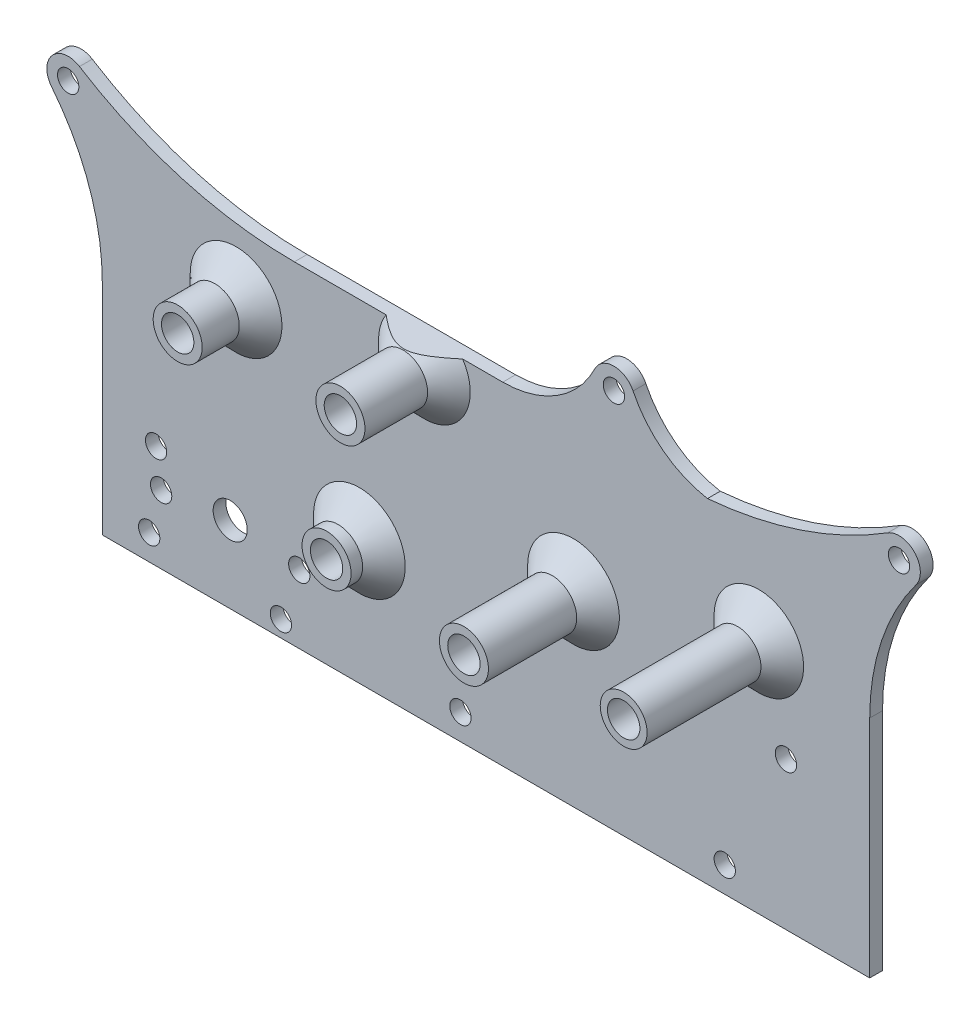
from build123d import *

# Parameters (mm, degrees)
SKETCH1_W           = 180
SKETCH1_H           = 78
SKETCH1_R           = 4
BOSS_EXTRUDE1_DEPTH = 3
SKETCH2_R           = 2.5
CUT_EXTRUDE1_DEPTH  = 3
SKETCH4_R           = 2.5
CUT_EXTRUDE3_DEPTH  = 10
SKETCH5_R           = 2.5
BOSS_EXTRUDE2_DEPTH = 3
SKETCH6_R           = 2.5
BOSS_EXTRUDE3_DEPTH = 3
SKETCH7_R           = 2.5
CUT_EXTRUDE4_DEPTH  = 179.975122888
SKETCH8_R           = 5.75
SKETCH8_R_2         = 3.8
BOSS_EXTRUDE4_DEPTH = 13.7
SKETCH9_R           = 5.75
SKETCH9_R_2         = 3.8
BOSS_EXTRUDE5_DEPTH = 7.7
SKETCH10_R          = 5.75
SKETCH10_R_2        = 3.8
BOSS_EXTRUDE6_DEPTH = 19.7
SKETCH11_R          = 5.75
SKETCH11_R_2        = 3.8
BOSS_EXTRUDE7_DEPTH = 25.7
CHAMFER1_SIZE       = 5
SKETCH12_R          = 5.5
SKETCH12_R_2        = 3.8
BOSS_EXTRUDE8_DEPTH = 31.7
CHAMFER2_SIZE       = 5
SKETCH13_R          = 2.5
CUT_EXTRUDE5_DEPTH  = 183.283253791


with BuildPart() as part:
    # Sketch1 → Boss-Extrude1 (new body)
    with BuildSketch(Plane.XY):
        with Locations((60, 21)):
            Rectangle(SKETCH1_W, SKETCH1_H)
        Circle(SKETCH1_R, mode=Mode.SUBTRACT)
    extrude(amount=BOSS_EXTRUDE1_DEPTH)

    # Sketch2 → Cut-Extrude1 (cut)
    with BuildSketch(Plane.XY.offset(3)):
        with Locations((1.379644584, 45.502149563)):
            Circle(SKETCH2_R)
        with Locations((30.30508702, 11.030149622)):
            Circle(SKETCH2_R)
        with Locations((45.55286784, 54.088554355)):
            Circle(SKETCH2_R)
        with Locations((80.524436105, 25.769136757)):
            Circle(SKETCH2_R)
        with Locations((123.991098288, 37.415993787)):
            Circle(SKETCH2_R)
        with Locations((130.350182866, 16.616365345)):
            Circle(SKETCH2_R)
    extrude(amount=-CUT_EXTRUDE1_DEPTH, mode=Mode.SUBTRACT)

    # Sketch4 → Cut-Extrude3 (cut)
    with BuildSketch(Plane.XY.offset(3)):
        with Locations((54, -12)):
            Circle(SKETCH4_R)
        with Locations((-19, -12)):
            Circle(SKETCH4_R)
        with Locations((116, -12)):
            Circle(SKETCH4_R)
    extrude(amount=-CUT_EXTRUDE3_DEPTH, mode=Mode.SUBTRACT)

    # Sketch5 → Boss-Extrude2 (add)
    # profile 1 of 2: a face of its own
    with BuildSketch(Plane.XY.offset(3)):
        with BuildLine():
            Line((116.068060007, 60), (116.068060007, 53.293456509))
            Line((116.068060007, 53.293456509), (63.931939993, 53.293456509))
            Line((63.931939993, 53.293456509), (63.931939993, 60))
            ThreePointArc((63.931939993, 60), (76.652430488, 63.648363172), (85.505506895, 73.48423987))
            ThreePointArc((85.505506895, 73.48423987), (90, 76.293456509), (94.494493105, 73.48423987))
            ThreePointArc((94.494493105, 73.48423987), (103.347569512, 63.648363172), (116.068060007, 60))
        make_face()
        with Locations((90, 71.293456509)):
            Circle(SKETCH5_R, mode=Mode.SUBTRACT)
    # profile 2 of 2: a face of its own
    with BuildSketch(Plane.XY.offset(3)):
        with BuildLine():
            Line((15.048465346, 60), (-9.629718418, 52.415464707))
            Line((-9.629718418, 52.415464707), (-30, 33.284639637))
            ThreePointArc((-30, 33.284639637), (-33.061352956, 51.208206171), (-41.898305085, 67.099537024))
            ThreePointArc((-41.898305085, 67.099537024), (-41.737026969, 73.552387313), (-35.347576733, 74.469018739))
            ThreePointArc((-35.347576733, 74.469018739), (-11.167529583, 63.688874665), (15.048465346, 60))
        make_face()
        with Locations((-38, 70.230546041)):
            Circle(SKETCH5_R, mode=Mode.SUBTRACT)
    extrude(amount=-BOSS_EXTRUDE2_DEPTH)

    # Sketch6 → Boss-Extrude3 (add)
    with BuildSketch(Plane.XY.offset(3)):
        with BuildLine():
            Line((103.71791688, 60), (150, 34.801241353))
            ThreePointArc((150, 34.801241353), (152.78836529, 51.929243873), (160.8654989, 67.28838981))
            ThreePointArc((160.8654989, 67.28838981), (160.554300014, 73.67838942), (154.213881277, 74.531636156))
            ThreePointArc((154.213881277, 74.531636156), (129.990577907, 63.705162892), (103.71791688, 60))
        make_face()
        with Locations((156.871563613, 70.296459112)):
            Circle(SKETCH6_R, mode=Mode.SUBTRACT)
    extrude(amount=-BOSS_EXTRUDE3_DEPTH)

    # Sketch7 → Cut-Extrude4 (cut, through all)
    with BuildSketch(Plane.XY.offset(3)):
        with Locations((11.891570779, -14.171822198)):
            Circle(SKETCH7_R)
        with Locations((-17.384313485, 6.327372652)):
            Circle(SKETCH7_R)
    extrude(amount=-CUT_EXTRUDE4_DEPTH, mode=Mode.SUBTRACT)

    # Sketch8 → Boss-Extrude4 (add)
    with BuildSketch(Plane.XY.offset(3)):
        with Locations(Location((1.379644584, 45.502149563, 0), (0, 0, 180))):
            Circle(SKETCH8_R)
        with Locations(Location((1.379644584, 45.502149563, 0), (0, 0, 180))):
            Circle(SKETCH8_R_2, mode=Mode.SUBTRACT)
    extrude(amount=BOSS_EXTRUDE4_DEPTH)

    # Sketch9 → Boss-Extrude5 (add)
    with BuildSketch(Plane.XY.offset(3)):
        with Locations(Location((30.30508702, 11.030149622, 0), (0, 0, 180))):
            Circle(SKETCH9_R)
        with Locations(Location((30.30508702, 11.030149622, 0), (0, 0, 180))):
            Circle(SKETCH9_R_2, mode=Mode.SUBTRACT)
    extrude(amount=BOSS_EXTRUDE5_DEPTH)

    # Sketch10 → Boss-Extrude6 (add)
    with BuildSketch(Plane.XY.offset(3)):
        with Locations(Location((45.55286784, 54.088554355, 0), (0, 0, 180))):
            Circle(SKETCH10_R)
        with Locations((45.55286784, 54.088554355)):
            Circle(SKETCH10_R_2, mode=Mode.SUBTRACT)
    extrude(amount=BOSS_EXTRUDE6_DEPTH)

    # Sketch11 → Boss-Extrude7 (add)
    with BuildSketch(Plane.XY.offset(3)):
        with Locations(Location((80.524436105, 25.769136757, 0), (0, 0, 180))):
            Circle(SKETCH11_R)
        with Locations(Location((80.524436105, 25.769136757, 0), (0, 0, 180))):
            Circle(SKETCH11_R_2, mode=Mode.SUBTRACT)
    extrude(amount=BOSS_EXTRUDE7_DEPTH)

    # Chamfer1
    # the kernel refuses this chamfer: 5 mm, written as the material it adds along each edge
    with BuildSketch(Plane(origin=(1.379644584, 45.502149563, 3), x_dir=(-1, 0, 0), z_dir=(0, 1, 0))) as chamfer1_piece_1:
        Polygon((5.75 + CHAMFER1_SIZE, 0), (5.75, CHAMFER1_SIZE), (5.75, 0), align=None)
    revolve(axis=Axis((1.379644584, 45.502149563, 3), (0, 0, 1)))
    with BuildSketch(Plane(origin=(30.30508702, 11.030149622, 3), x_dir=(-1, 0, 0), z_dir=(0, 1, 0))) as chamfer1_piece_2:
        Polygon((5.75 + CHAMFER1_SIZE, 0), (5.75, CHAMFER1_SIZE), (5.75, 0), align=None)
    revolve(axis=Axis((30.30508702, 11.030149622, 3), (0, 0, 1)))
    with BuildSketch(Plane(origin=(45.55286784, 54.088554355, 3), x_dir=(-1, 0, 0), z_dir=(0, 1, 0))) as chamfer1_piece_3_section:
        Polygon((5.75 + CHAMFER1_SIZE, 0), (5.75, CHAMFER1_SIZE), (5.75, 0), align=None)
    chamfer1_piece_3 = revolve(axis=Axis((45.55286784, 54.088554355, 3), (0, 0, 1)), mode=Mode.PRIVATE)
    chamfer1_piece_3 = split(chamfer1_piece_3, bisect_by=Plane(origin=(53.746055157, 60, 5.443187317), z_dir=(0, -1, 0)), keep=Keep.TOP, mode=Mode.PRIVATE)
    add(chamfer1_piece_3)
    with BuildSketch(Plane(origin=(80.524436105, 25.769136757, 3), x_dir=(-1, 0, 0), z_dir=(0, 1, 0))) as chamfer1_piece_4:
        Polygon((5.75 + CHAMFER1_SIZE, 0), (5.75, CHAMFER1_SIZE), (5.75, 0), align=None)
    revolve(axis=Axis((80.524436105, 25.769136757, 3), (0, 0, 1)))

    # Sketch12 → Boss-Extrude8 (add)
    with BuildSketch(Plane.XY.offset(3)):
        with Locations(Location((123.991098288, 37.415993787, 0), (0, 0, 180))):
            Circle(SKETCH12_R)
        with Locations((123.991098288, 37.415993787)):
            Circle(SKETCH12_R_2, mode=Mode.SUBTRACT)
    extrude(amount=BOSS_EXTRUDE8_DEPTH)

    # Chamfer2
    chamfer2_edges = [part.edges().sort_by_distance(p)[0] for p in [
        (129.491098288, 37.415993787, 3),
    ]]
    chamfer(chamfer2_edges, length=CHAMFER2_SIZE)

    # Sketch13 → Cut-Extrude5 (cut, through all)
    with BuildSketch(Plane(origin=(0, 0, 0), x_dir=(-1, 0, 0), z_dir=(0, 0, -1))):
        with Locations((-16.2, -2)):
            Circle(SKETCH13_R)
        with Locations((16.2, -2)):
            Circle(SKETCH13_R)
    extrude(amount=-CUT_EXTRUDE5_DEPTH, mode=Mode.SUBTRACT)


solid = part.part
